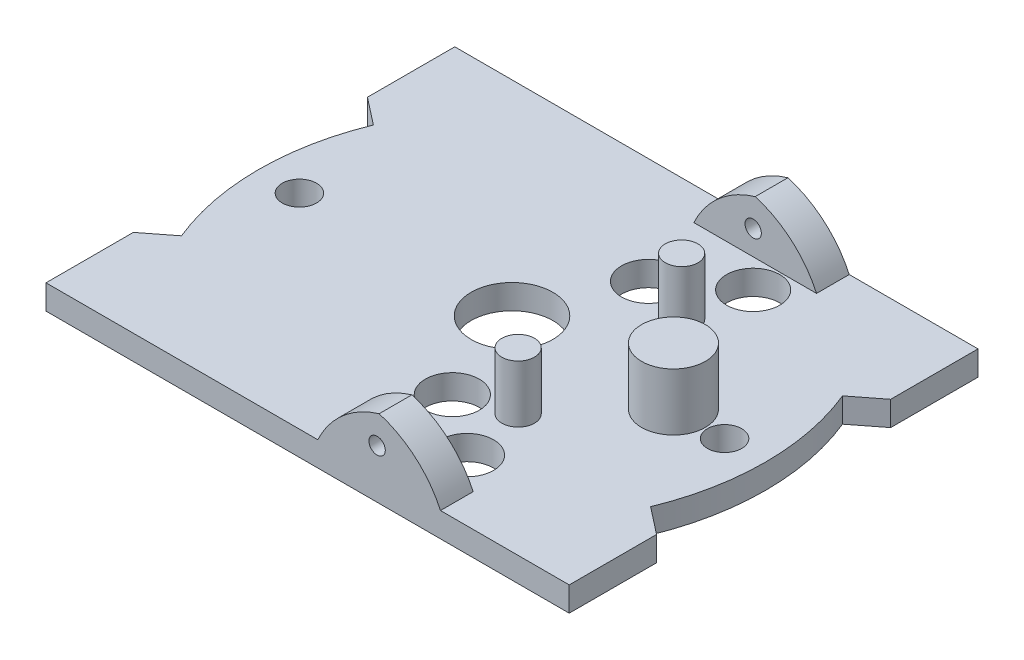
from build123d import *

# Parameters (mm, degrees)
SKETCH1_R               = 2.1
BOSS_EXTRUDE2_DEPTH     = 3
SKETCH1_14_R            = 5
CUT_EXTRUDE2_DEPTH      = 10
SKETCH2_R               = 2
SKETCH2_W               = 15
SKETCH2_H               = 4
SKETCH2_R_2             = 3.9
BOSS_EXTRUDE3_DEPTH     = 7
SKETCH2_4_R             = 3.25
SKETCH2_4_R_2           = 3.3
CUT_EXTRUDE3_DEPTH      = 7
CUT_EXTRUDE4_DEPTH      = 61.199667773
CUT_EXTRUDE4_DEPTH_BACK = 7
SKETCH3_R               = 1
FILLET1_R               = 12
CUT_EXTRUDE5_START      = -41
SKETCH3_3_R             = 1
CUT_EXTRUDE5_DEPTH      = 9


with BuildPart() as part:
    # Sketch1 → Boss-Extrude2 (new body)
    with BuildSketch(Plane(origin=(0, 0, 0), x_dir=(1, 0, 0), z_dir=(0, 1, 0))):
        with BuildLine():
            Line((32, -25), (32, -14.320549047))
            Line((32, -14.320549047), (28.692414075, -11.736497543))
            ThreePointArc((28.692414075, -11.736497543), (31, 0), (28.692414075, 11.736497543))
            Line((28.692414075, 11.736497543), (32, 14.320549047))
            Line((32, 14.320549047), (32, 25))
            Line((32, 25), (-32, 25))
            Line((-32, 25), (-32, 14.320549047))
            Line((-32, 14.320549047), (-28.692414075, 11.736497543))
            ThreePointArc((-28.692414075, 11.736497543), (-31, 0), (-28.692414075, -11.736497543))
            Line((-28.692414075, -11.736497543), (-32, -14.320549047))
            Line((-32, -14.320549047), (-32, -25))
            Line((-32, -25), (32, -25))
        make_face()
        with Locations(Location((26, 0, 0), (0, 0, 270))):
            Circle(SKETCH1_R, mode=Mode.SUBTRACT)
        with Locations(Location((-26, 0, 0), (0, 0, 270))):
            Circle(SKETCH1_R, mode=Mode.SUBTRACT)
    extrude(amount=BOSS_EXTRUDE2_DEPTH)

    # Sketch1<14> → Cut-Extrude2 (cut)
    with BuildSketch(Plane(origin=(0, 0, 0), x_dir=(1, 0, 0), z_dir=(0, 1, 0))):
        with Locations(Location((0, 0, 0), (0, 0, 270))):
            Circle(SKETCH1_14_R)
    extrude(amount=CUT_EXTRUDE2_DEPTH, mode=Mode.SUBTRACT)

    # Sketch2 → Boss-Extrude3 (add)
    with BuildSketch(Plane(origin=(0, 3, 0), x_dir=(1, 0, 0), z_dir=(0, 1, 0))):
        with Locations(Location((10.75, -10, 0), (0, 0, 269.999999999))):
            Circle(SKETCH2_R)
        Polygon((8.75, -21), (1.25, -21), (1.25, -25), (16.25, -25), (16.25, -21), align=None)
        with Locations((8.75, 23)):
            Rectangle(SKETCH2_W, SKETCH2_H)
        with Locations(Location((19.75, 0, 0), (0, 0, 270))):
            Circle(SKETCH2_R_2)
        with Locations(Location((10.75, 10, 0), (0, 0, 270))):
            Circle(SKETCH2_R)
    extrude(amount=BOSS_EXTRUDE3_DEPTH)

    # Sketch2<4> → Cut-Extrude3 (cut)
    with BuildSketch(Plane(origin=(0, 3, 0), x_dir=(1, 0, 0), z_dir=(0, 1, 0))):
        with Locations(Location((12, 17.5, 0), (0, 0, 270))):
            Circle(SKETCH2_4_R)
        with Locations(Location((4.7, 12, 0), (0, 0, 270))):
            Circle(SKETCH2_4_R_2)
        with Locations(Location((12, -17.5, 0), (0, 0, 270))):
            Circle(SKETCH2_4_R)
        with Locations(Location((4.7, -12, 0), (0, 0, 270))):
            Circle(SKETCH2_4_R_2)
    extrude(amount=-CUT_EXTRUDE3_DEPTH, mode=Mode.SUBTRACT)

    # Sketch3 → Cut-Extrude4 (cut, two sides: drawn at the far end of the back side and taken through both)
    with BuildSketch(Plane.XY.offset(25).offset(-CUT_EXTRUDE4_DEPTH_BACK)):
        with Locations(Location((8.5, 6, 0), (0, 0, 180))):
            Circle(SKETCH3_R)
    extrude(amount=CUT_EXTRUDE4_DEPTH + CUT_EXTRUDE4_DEPTH_BACK, mode=Mode.SUBTRACT)

    # Fillet1
    # the kernel refuses this fillet: 12 mm, written as the material it takes off along each edge
    with BuildSketch(Plane(origin=(1.25, 10, -52.271780287), x_dir=(0, -1, 0), z_dir=(0, 0, 1)), Plane(origin=(16.25, 10, -21), x_dir=(0, -1, 0), z_dir=(0, 0, -1)), Plane(origin=(1.25, 10, 21), x_dir=(0, -1, 0), z_dir=(0, 0, 1)), Plane(origin=(16.25, 10, 52.271780287), x_dir=(0, -1, 0), z_dir=(0, 0, -1))) as fillet1_piece_1:
        with BuildLine():
            CenterArc((12, 10.908712115), FILLET1_R, 180, 65.375681648)
            Line((0, 10.908712115), (0, 0))
            Line((0, 0), (7, 0))
        make_face()
    extrude(amount=31.271780287, mode=Mode.SUBTRACT)

    # Sketch3<3> → Cut-Extrude5 (cut)
    with BuildSketch(Plane.XY.offset(25).offset(CUT_EXTRUDE5_START)):
        with Locations(Location((8.5, 6, 0), (0, 0, 180))):
            Circle(SKETCH3_3_R)
    extrude(amount=-CUT_EXTRUDE5_DEPTH, mode=Mode.SUBTRACT)


solid = part.part
